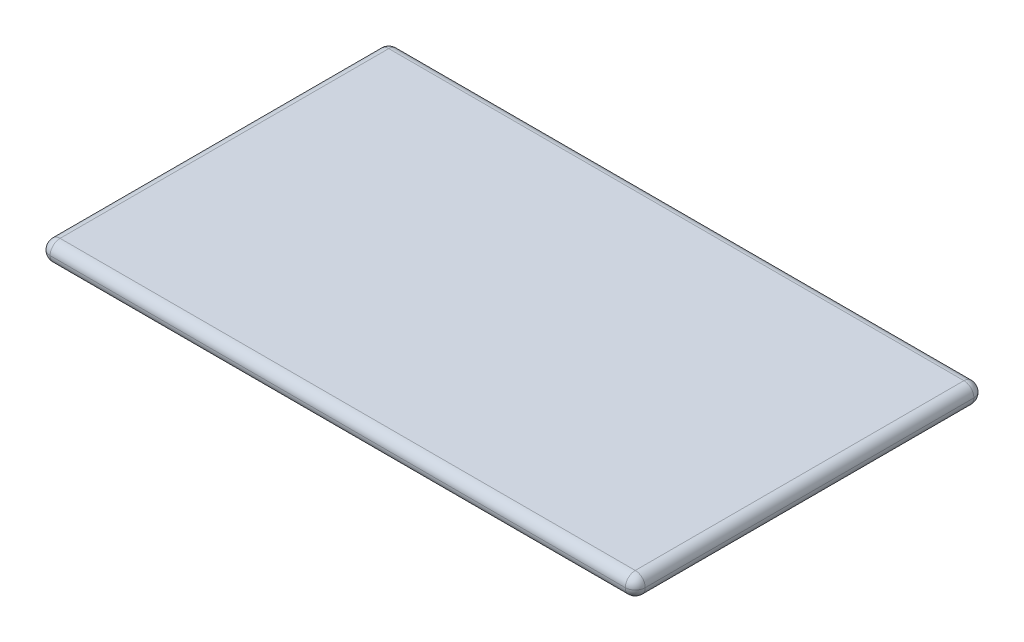
from build123d import *

# Parameters (mm, degrees)
BOSS_EXTRUDE1_DEPTH = 3.556
FILLET3_R           = 0.2032


with BuildPart() as part:
    # Sketch1 → Boss-Extrude1 (new, symmetric)
    with BuildSketch(Plane.XY):
        Polygon((6.0706, 0.2032), (-6.0706, 0.2032), (-6.0706, -0.2032), (5.6642, -0.2032), (6.0706, -0.2032), align=None)
    extrude(amount=BOSS_EXTRUDE1_DEPTH, both=True)

    # Fillet3
    fillet3_edges = [part.edges().sort_by_distance(p)[0] for p in [
        (-6.0706, 0, 3.556),
        (0, -0.2032, 3.556),
        (6.0706, 0, 3.556),
        (0, -0.2032, -3.556),
        (-6.0706, 0, -3.556),
        (0, 0.2032, -3.556),
        (6.0706, 0, -3.556),
        (6.0706, -0.2032, 0),
        (-6.0706, -0.2032, 0),
        (0, 0.2032, 3.556),
        (-6.0706, 0.2032, 0),
        (6.0706, 0.2032, 0),
    ]]
    fillet(fillet3_edges, radius=FILLET3_R - 0.0001)  # a hair under: the kernel refuses the full size


solid = part.part
